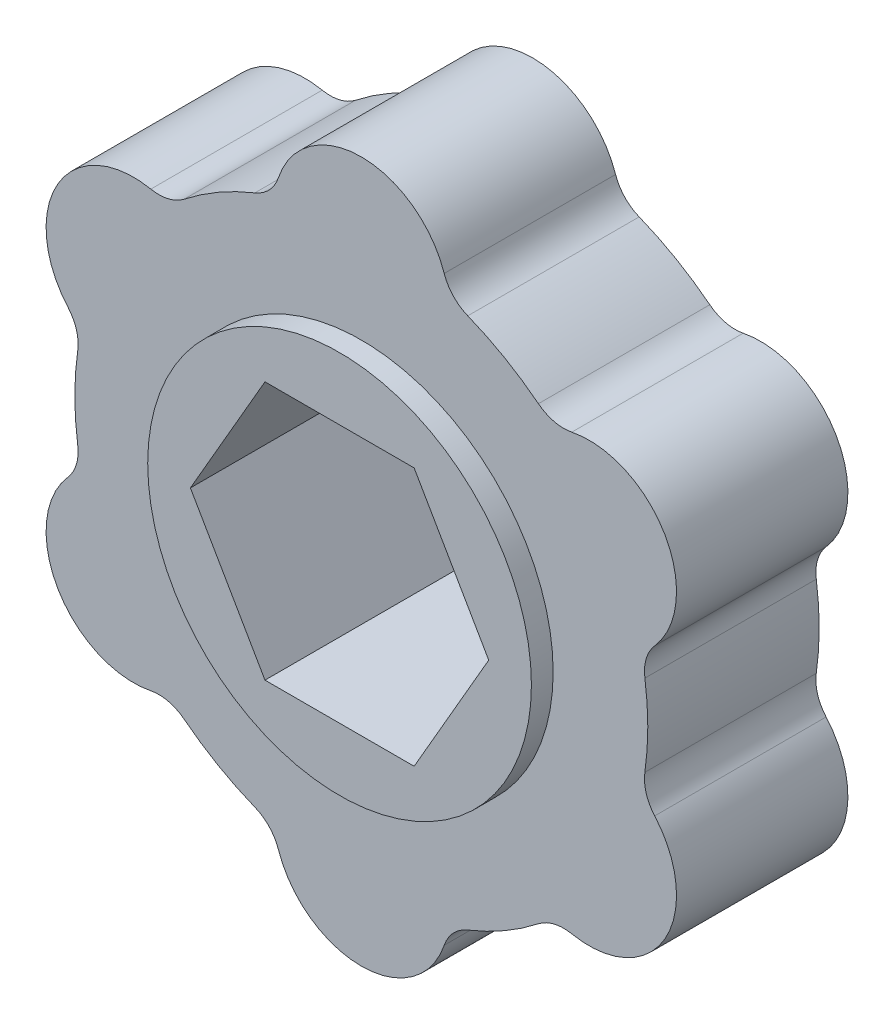
from build123d import *

# Parameters (mm, degrees)
BOSS_EXTRUDE2_DEPTH = 8.509
FILLET1_R           = 2.032
CUT_EXTRUDE1_DEPTH  = 25.900744443
SKETCH7_R           = 9.525
BOSS_EXTRUDE3_DEPTH = 1.0795
BOSS_EXTRUDE4_START = 1.0795
SKETCH8_R           = 9.525
BOSS_EXTRUDE4_DEPTH = 1.0795


with BuildPart() as part:
    # Sketch5 → Boss-Extrude2 (new body)
    with BuildSketch(Plane.XY):
        with BuildLine():
            ThreePointArc((13.895294195, -3.040226179), (14.224, 0), (13.895294195, 3.040226179))
            ThreePointArc((13.895294195, 3.040226179), (15.067976, 8.6995), (9.580560202, 10.513564677))
            ThreePointArc((9.580560202, 10.513564677), (7.112, 12.318345343), (4.314733993, 13.553790856))
            ThreePointArc((4.314733993, 13.553790856), (0, 17.399), (-4.314733993, 13.553790856))
            ThreePointArc((-4.314733993, 13.553790856), (-7.112, 12.318345343), (-9.580560202, 10.513564677))
            ThreePointArc((-9.580560202, 10.513564677), (-15.067976, 8.6995), (-13.895294195, 3.040226179))
            ThreePointArc((-13.895294195, 3.040226179), (-14.224, 0), (-13.895294195, -3.040226179))
            ThreePointArc((-13.895294195, -3.040226179), (-15.067976, -8.6995), (-9.580560202, -10.513564677))
            ThreePointArc((-9.580560202, -10.513564677), (-7.112, -12.318345343), (-4.314733993, -13.553790856))
            ThreePointArc((-4.314733993, -13.553790856), (0, -17.399), (4.314733993, -13.553790856))
            ThreePointArc((4.314733993, -13.553790856), (7.112, -12.318345343), (9.580560202, -10.513564677))
            ThreePointArc((9.580560202, -10.513564677), (15.067976, -8.6995), (13.895294195, -3.040226179))
        make_face()
    extrude(amount=BOSS_EXTRUDE2_DEPTH)

    # Fillet1
    fillet1_edges = [part.edges().sort_by_distance(p)[0] for p in [
        (-9.580560202, 10.513564677, 4.2545),
        (-4.314733993, 13.553790856, 4.2545),
        (4.314733993, 13.553790856, 4.2545),
        (9.580560202, 10.513564677, 4.2545),
        (13.895294195, 3.040226179, 4.2545),
        (13.895294195, -3.040226179, 4.2545),
        (9.580560202, -10.513564677, 4.2545),
        (4.314733993, -13.553790856, 4.2545),
        (-4.314733993, -13.553790856, 4.2545),
        (-9.580560202, -10.513564677, 4.2545),
        (-13.895294195, -3.040226179, 4.2545),
        (-13.895294195, 3.040226179, 4.2545),
    ]]
    fillet(fillet1_edges, radius=FILLET1_R)

    # Sketch6 → Cut-Extrude1 (cut, through all)
    with BuildSketch(Plane.XY.offset(8.509)):
        Polygon((7.405671903, 0), (3.702835951, 6.4135), (-3.702835951, 6.4135), (-7.405671903, 0), (-3.702835951, -6.4135), (3.702835951, -6.4135), align=None)
    extrude(amount=-CUT_EXTRUDE1_DEPTH, mode=Mode.SUBTRACT)

    # Sketch7 → Boss-Extrude3 (add)
    with BuildSketch(Plane(origin=(0, 0, 0), x_dir=(-1, 0, 0), z_dir=(0, 0, -1))):
        Circle(SKETCH7_R)
        Polygon((-7.405671903, 0), (-3.702835951, 6.4135), (3.702835951, 6.4135), (7.405671903, 0), (3.702835951, -6.4135), (-3.702835951, -6.4135), align=None, mode=Mode.SUBTRACT)
    extrude(amount=BOSS_EXTRUDE3_DEPTH)

    # Sketch8 → Boss-Extrude4 (add)
    with BuildSketch(Plane.XY.offset(8.509).offset(BOSS_EXTRUDE4_START)):
        Circle(SKETCH8_R)
        Polygon((3.702835951, -6.4135), (7.405671903, 0), (3.702835951, 6.4135), (-3.702835951, 6.4135), (-7.405671903, 0), (-3.702835951, -6.4135), align=None, mode=Mode.SUBTRACT)
    extrude(amount=-BOSS_EXTRUDE4_DEPTH)


solid = part.part
